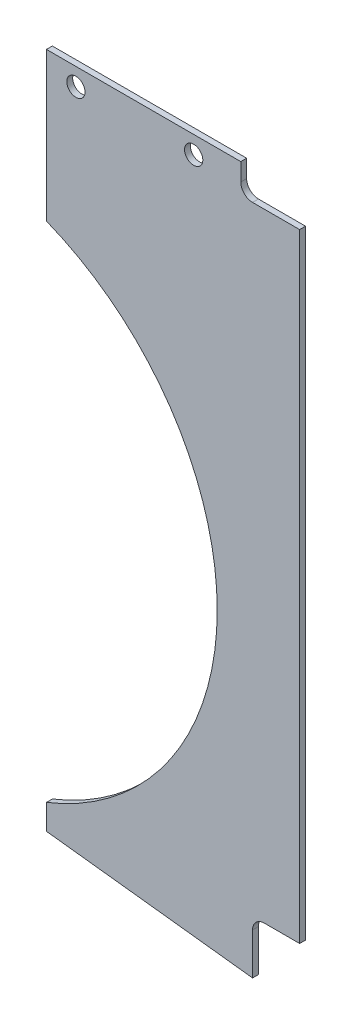
from build123d import *

# Parameters (mm, degrees)
SKETCH_1_R          = 1.55
EXTRUDE_1_DEPTH     = 1
SKETCH_2_R          = 46
CUT_EXTRUDE_1_DEPTH = 2
SKETCH_3_W          = 8
SKETCH_3_H          = 10
CUT_EXTRUDE_2_DEPTH = 10
SKETCH_4_W          = 10
SKETCH_4_H          = 5
CUT_EXTRUDE_3_DEPTH = 123.780291578
FILLET_1_R          = 2


with BuildPart() as part:
    # 草图1 → 凸台-拉伸1 (new body)
    with BuildSketch(Plane.XY):
        Polygon((0, 0), (0, 115), (43, 115), (43, -5), align=None)
        with Locations((5, 112)):
            Circle(SKETCH_1_R, mode=Mode.SUBTRACT)
        with Locations((25, 112)):
            Circle(SKETCH_1_R, mode=Mode.SUBTRACT)
    extrude(amount=EXTRUDE_1_DEPTH)

    # 草图2 → 切除-拉伸1 (cut)
    with BuildSketch(Plane.XY.offset(1)):
        with Locations((-17, 47)):
            Circle(SKETCH_2_R)
    extrude(amount=-CUT_EXTRUDE_1_DEPTH, mode=Mode.SUBTRACT)

    # 草图3 → 切除-拉伸2 (cut)
    with BuildSketch(Plane.XY.offset(1)):
        with Locations((39, 0)):
            Rectangle(SKETCH_3_W, SKETCH_3_H)
    extrude(amount=-CUT_EXTRUDE_2_DEPTH, mode=Mode.SUBTRACT)

    # 草图4 → 切除-拉伸3 (cut, through all)
    with BuildSketch(Plane.XY.offset(1)):
        with Locations((38, 112.5)):
            Rectangle(SKETCH_4_W, SKETCH_4_H)
    extrude(amount=-CUT_EXTRUDE_3_DEPTH, mode=Mode.SUBTRACT)

    # 圆角1
    fillet_1_edges = [part.edges().sort_by_distance(p)[0] for p in [
        (33, 110, 0.5),
        (35, 5, 0.5),
    ]]
    fillet(fillet_1_edges, radius=FILLET_1_R)


solid = part.part
